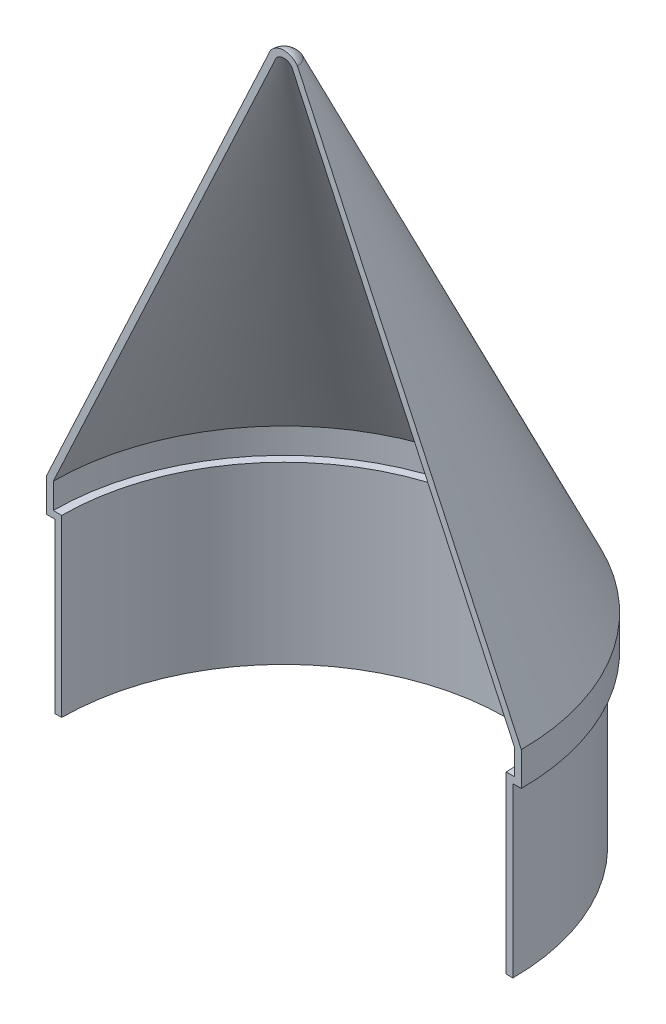
from build123d import *

# Parameters (mm, degrees)
SHELL1_T           = -2
CUT_EXTRUDE1_DEPTH = 184.969188976


with BuildPart() as part:
    # Sketch3 → Revolve1 (revolve)
    with BuildSketch(Plane.XY):
        with BuildLine():
            Line((0, 0), (0, 154.609710214))
            ThreePointArc((0, 154.609710214), (2.236067977, 154.081846169), (4, 152.609710214))
            Line((4, 152.609710214), (70.5, 10))
            Line((70.5, 10), (70.5, 0))
            Line((70.5, 0), (68, 0))
            Line((68, 0), (68, -50))
            Line((68, -50), (0, -50))
            Line((0, -50), (0, 0))
        make_face()
    revolve(axis=Axis((0, 0, 0), (0, 1, 0)))

    # Shell1
    shell1_openings = [part.faces().sort_by_distance(p)[0] for p in [
        (0, -50, 0),
    ]]
    offset(amount=SHELL1_T, openings=shell1_openings, kind=Kind.INTERSECTION)

    # Sketch4 → Cut-Extrude1 (cut, through all)
    with BuildSketch(Plane.XY):
        with BuildLine():
            Line((68, -50), (-68, -50))
            Line((-68, -50), (-68, 0))
            Line((-68, 0), (-70.5, 0))
            Line((-70.5, 0), (-70.5, 10))
            Line((-70.5, 10), (-4, 152.609710214))
            ThreePointArc((-4, 152.609710214), (0, 154.609710214), (4, 152.609710214))
            Line((4, 152.609710214), (70.5, 10))
            Line((70.5, 10), (70.5, 0))
            Line((70.5, 0), (68, 0))
            Line((68, 0), (68, -50))
        make_face()
    extrude(amount=CUT_EXTRUDE1_DEPTH, mode=Mode.SUBTRACT)


solid = part.part
